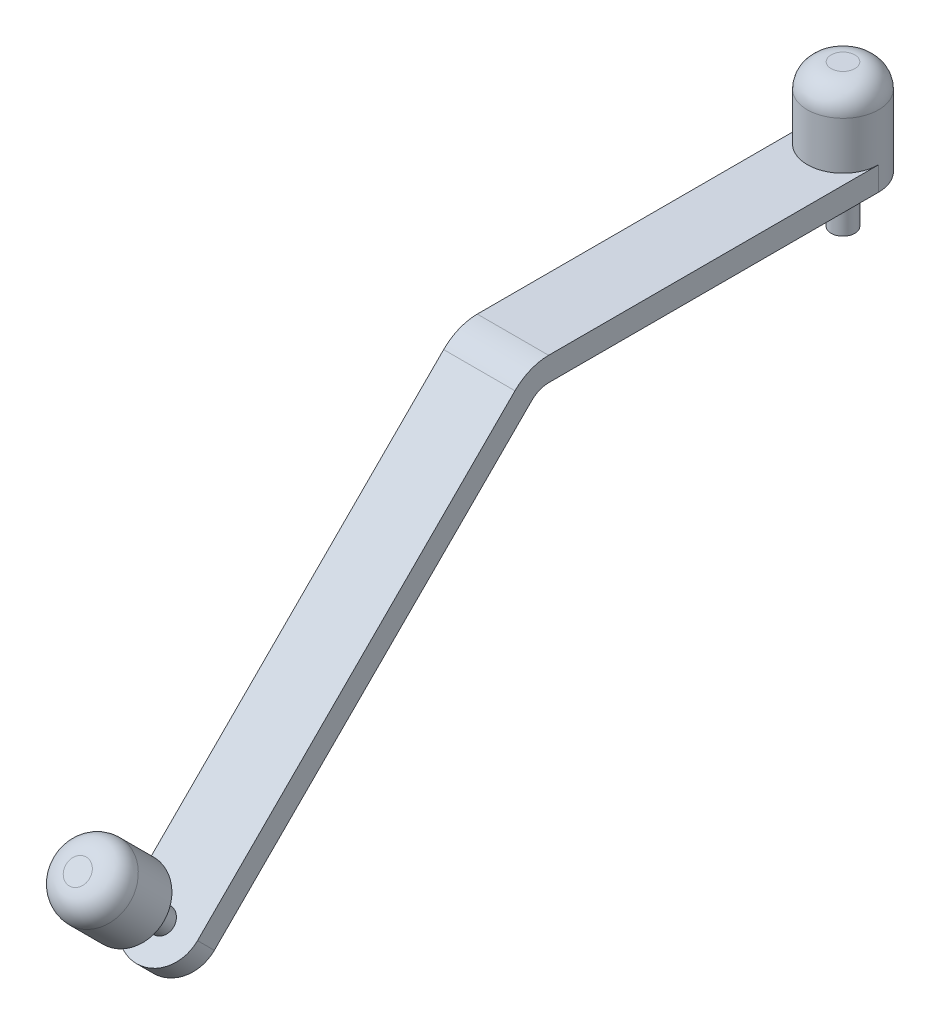
from build123d import *

# Parameters (mm, degrees)
BOSS_EXTRUDE1_DEPTH = 30
FILLET1_R           = 10
FILLET2_R           = 20
FILLET3_R           = 15
FILLET4_R           = 15
SKETCH2_R           = 5
BOSS_EXTRUDE2_DEPTH = 20
SKETCH3_R           = 15
BOSS_EXTRUDE3_DEPTH = 30
FILLET5_R           = 10
SKETCH4_R           = 5
BOSS_EXTRUDE4_DEPTH = 20
SKETCH5_R           = 15
BOSS_EXTRUDE5_DEPTH = 30
FILLET6_R           = 10


with BuildPart() as part:
    # Sketch1 → Boss-Extrude1 (new body)
    with BuildSketch(Plane(origin=(0, 0, 0), x_dir=(0, 0, -1), z_dir=(1, 0, 0))):
        Polygon((-224.956890143, -152.027957955), (-77.928932188, -5), (80, -5), (80, 5), (-82.071067812, 5), (-232.027957955, -144.956890143), align=None)
    extrude(amount=BOSS_EXTRUDE1_DEPTH)

    # Fillet1
    fillet1_edges = [part.edges().sort_by_distance(p)[0] for p in [
        (15, -5, 77.928932188),
    ]]
    fillet(fillet1_edges, radius=FILLET1_R)

    # Fillet2
    fillet2_edges = [part.edges().sort_by_distance(p)[0] for p in [
        (15, 5, 82.071067812),
    ]]
    fillet(fillet2_edges, radius=FILLET2_R)

    # Fillet3
    fillet3_edges = [part.edges().sort_by_distance(p)[0] for p in [
        (30, -148.492424049, 228.492424049),
        (0, -148.492424049, 228.492424049),
    ]]
    fillet(fillet3_edges, radius=FILLET3_R - 0.0001)  # a hair under: the kernel refuses the full size

    # Fillet4
    fillet4_edges = [part.edges().sort_by_distance(p)[0] for p in [
        (30, 0, -80),
        (0, 0, -80),
    ]]
    fillet(fillet4_edges, radius=FILLET4_R - 0.0001)  # a hair under: the kernel refuses the full size

    # Sketch2 → Boss-Extrude2 (add)
    with BuildSketch(Plane(origin=(0, 43.535533906, 43.535533906), x_dir=(1, 0, 0), z_dir=(0, 0.7071067811865471, 0.7071067811865479))):
        with Locations(Location((15, -251.568542495, 0), (0, 0, 270))):
            Circle(SKETCH2_R)
    extrude(amount=BOSS_EXTRUDE2_DEPTH)

    # Sketch3 → Boss-Extrude3 (add)
    with BuildSketch(Plane(origin=(0, 57.67766953, 57.67766953), x_dir=(1, 0, 0), z_dir=(0, 0.7071067811865471, 0.7071067811865479))):
        with Locations(Location((15, -251.568542495, 0), (0, 0, 270))):
            Circle(SKETCH3_R)
    extrude(amount=BOSS_EXTRUDE3_DEPTH)

    # Fillet5
    fillet5_edges = [part.edges().sort_by_distance(p)[0] for p in [
        (15, -88.388347648, 246.170093579),
    ]]
    fillet(fillet5_edges, radius=FILLET5_R)

    # Sketch4 → Boss-Extrude4 (add)
    with BuildSketch(Plane.XZ.offset(5)):
        with Locations(Location((15, -65, 0), (0, 0, 90))):
            Circle(SKETCH4_R)
    extrude(amount=BOSS_EXTRUDE4_DEPTH)

    # Sketch5 → Boss-Extrude5 (add)
    with BuildSketch(Plane(origin=(0, 5, 0), x_dir=(1, 0, 0), z_dir=(0, 1, 0))):
        with Locations(Location((15, 65, 0), (0, 0, 270))):
            Circle(SKETCH5_R)
    extrude(amount=BOSS_EXTRUDE5_DEPTH)

    # Fillet6
    fillet6_edges = [part.edges().sort_by_distance(p)[0] for p in [
        (15, 35, -80),
    ]]
    fillet(fillet6_edges, radius=FILLET6_R)


solid = part.part
